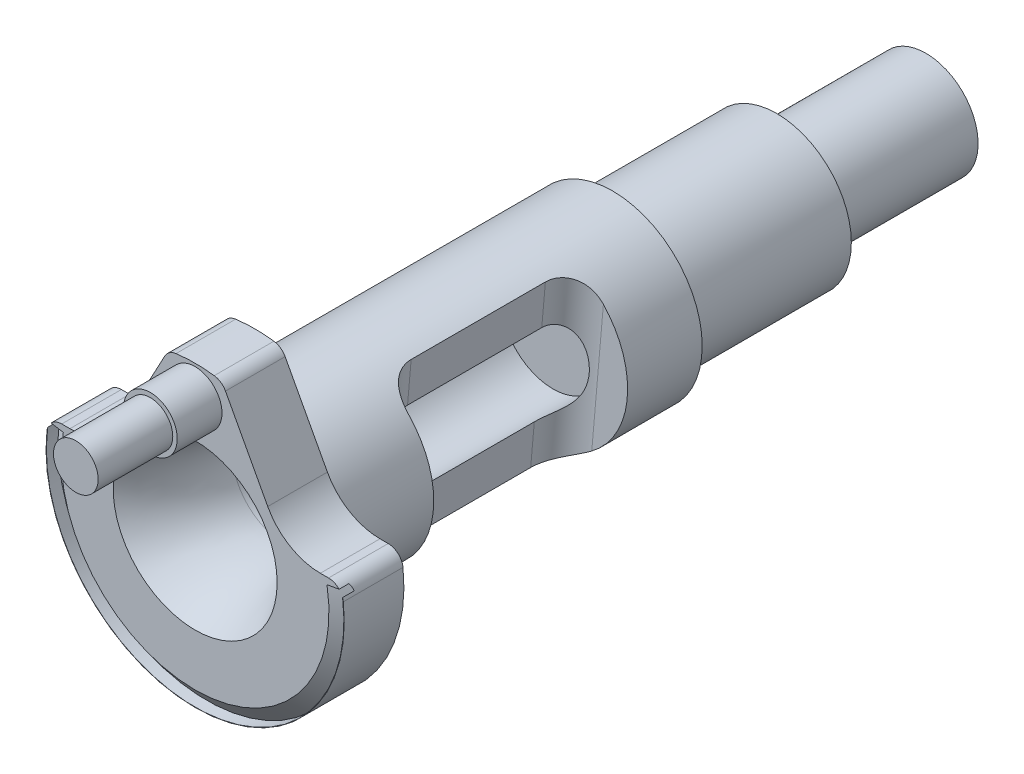
from build123d import *

# Parameters (mm, degrees)
SKETCH1_R           = 5
BOSS_EXTRUDE1_DEPTH = 35
SKETCH3_R           = 10
BOSS_EXTRUDE3_DEPTH = 4
BOSS_EXTRUDE4_START = 24
SKETCH4_R           = 6
SKETCH4_R_2         = 5
BOSS_EXTRUDE4_DEPTH = 24
CUT_EXTRUDE1_DEPTH  = 42.484937025
FILLET1_R           = 1
SKETCH6_R           = 3.5
CUT_EXTRUDE2_DEPTH  = 24
CHAMFER1_SIZE       = 2
FILLET2_R           = 10
SKETCH7_R           = 1.5
BOSS_EXTRUDE5_DEPTH = 8
FILLET3_R           = 4
CUT_REVOLVE1_ANGLE  = 200
SKETCH9_R           = 1.8
SKETCH9_R_2         = 1.5
BOSS_EXTRUDE6_DEPTH = 3
SKETCH10_R          = 3.5
BOSS_EXTRUDE7_DEPTH = 10
SKETCH14_W          = 13
SKETCH14_H          = 12
CUT_EXTRUDE3_DEPTH  = 4
FILLET4_R           = 2


with BuildPart() as part:
    # Sketch1 → Boss-Extrude1 (new body)
    with BuildSketch(Plane.XY):
        Circle(SKETCH1_R)
    extrude(amount=BOSS_EXTRUDE1_DEPTH)

    # Sketch3 → Boss-Extrude3 (add)
    with BuildSketch(Plane.XY.offset(35)):
        Circle(SKETCH3_R)
    extrude(amount=BOSS_EXTRUDE3_DEPTH)

    # Sketch4 → Boss-Extrude4 (add)
    with BuildSketch(Plane(origin=(0, 0, 35), x_dir=(-1, 0, 0), z_dir=(0, 0, -1)).offset(BOSS_EXTRUDE4_START)):
        with Locations(Location((0, 0, 0), (0, 0, 180))):
            Circle(SKETCH4_R)
        Circle(SKETCH4_R_2, mode=Mode.SUBTRACT)
    extrude(amount=-BOSS_EXTRUDE4_DEPTH)

    # Sketch5 → Cut-Extrude1 (cut, through all)
    with BuildSketch(Plane.XY.offset(39)):
        with BuildLine():
            ThreePointArc((-1.8, 9.836666102), (-6.99867823, 7.142723782), (-9.797958971, 2))
            Line((-9.797958971, 2), (-6, 2))
            Line((-6, 2), (-1.8, 9.836666102))
        make_face()
        with BuildLine():
            ThreePointArc((9.797958971, 2), (6.99867823, 7.142723782), (1.8, 9.836666102))
            Line((1.8, 9.836666102), (6, 2))
            Line((6, 2), (9.797958971, 2))
        make_face()
    extrude(amount=-CUT_EXTRUDE1_DEPTH, mode=Mode.SUBTRACT)

    # Fillet1
    fillet1_edges = [part.edges().sort_by_distance(p)[0] for p in [
        (-9.797958971, 2, 37),
        (-1.8, 9.836666102, 37),
        (1.8, 9.836666102, 37),
        (9.797958971, 2, 37),
    ]]
    fillet(fillet1_edges, radius=FILLET1_R)

    # Sketch6 → Cut-Extrude2 (cut)
    with BuildSketch(Plane.XY.offset(39)):
        Circle(SKETCH6_R)
    extrude(amount=-CUT_EXTRUDE2_DEPTH, mode=Mode.SUBTRACT)

    # Chamfer1
    chamfer1_edges = [part.edges().sort_by_distance(p)[0] for p in [
        (-3.5, 0, 39),
    ]]
    chamfer(chamfer1_edges, length=CHAMFER1_SIZE)

    # Fillet2
    # the kernel refuses this fillet: 10 mm, written as the material it takes off along each edge
    with BuildSketch(Plane(origin=(0, 0, 37), x_dir=(1, 0, 0), z_dir=(0, -1, 0))) as fillet2_piece_1:
        with BuildLine():
            CenterArc((13.5, -4), FILLET2_R, 143.130102354, 36.869897646)
            Line((3.5, -4), (3.3, -4))
            Line((3.3, -4), (3.3, 0))
            Line((3.3, 0), (3.358578644, 0.141421356))
            ThreePointArc((3.358578644, 0.141421356), (4.358578644, 1.141421356), (5.34, 2.12))
            Line((5.34, 2.12), (5.5, 2))
        make_face()
    revolve(axis=Axis((0, 0, 37), (0, 0, 1)), mode=Mode.SUBTRACT)

    # Sketch7 → Boss-Extrude5 (add)
    with BuildSketch(Plane.XY.offset(39)):
        with Locations((0, 8)):
            Circle(SKETCH7_R)
    extrude(amount=BOSS_EXTRUDE5_DEPTH)

    # Fillet3
    fillet3_edges = [part.edges().sort_by_distance(p)[0] for p in [
        (-6, 2, 37),
        (6, 2, 37),
    ]]
    fillet(fillet3_edges, radius=FILLET3_R)

    # Sketch8 → Cut-Revolve1 (revolve, symmetric, cut)
    with BuildSketch(Plane(origin=(0, 0, 0), x_dir=(0, 0, -1), z_dir=(1, 0, 0))) as cut_revolve1_sk:
        Polygon((-38.217890117, -9.976578367), (-39, -8.976578367), (-39, -9.976578367), align=None)
    revolve(axis=Axis((0, 0, 1000), (0, 0, -1)), revolution_arc=CUT_REVOLVE1_ANGLE / 2, mode=Mode.SUBTRACT)
    revolve(cut_revolve1_sk.sketch, axis=Axis((0, 0, 1000), (0, 0, 1)), revolution_arc=CUT_REVOLVE1_ANGLE / 2, mode=Mode.SUBTRACT)

    # Sketch9 → Boss-Extrude6 (add)
    with BuildSketch(Plane.XY.offset(39)):
        with Locations((0, 8)):
            Circle(SKETCH9_R)
        with Locations((0, 8)):
            Circle(SKETCH9_R_2, mode=Mode.SUBTRACT)
    extrude(amount=BOSS_EXTRUDE6_DEPTH)

    # Sketch10 → Boss-Extrude7 (add)
    with BuildSketch(Plane(origin=(0, 0, 0), x_dir=(-1, 0, 0), z_dir=(0, 0, -1))):
        with Locations(Location((0, 0, 0), (0, 0, 180))):
            Circle(SKETCH10_R)
    extrude(amount=BOSS_EXTRUDE7_DEPTH)

    # Sketch14 → Cut-Extrude3 (cut)
    with BuildSketch(Plane(origin=(5.977168189, -0.522934456, 0), x_dir=(0, 0, -1), z_dir=(0.9961946980917453, -0.08715574274766187, 0))):
        with Locations((-22.5, 0)):
            Rectangle(SKETCH14_W, SKETCH14_H)
    extrude(amount=-CUT_EXTRUDE3_DEPTH, mode=Mode.SUBTRACT)

    # Fillet4
    # the kernel refuses this fillet: 2 mm, written as the material it adds along each edge
    with BuildSketch(Plane(origin=(1.806946495, -2.29393355, 16), x_dir=(0, 0, 1), z_dir=(0.08715574274766187, 0.9961946980917453, 0))) as fillet4_piece_1_section:
        with BuildLine():
            CenterArc((FILLET4_R, FILLET4_R), FILLET4_R, 180, 90)
            Line((0, FILLET4_R), (0, 0))
            Line((0, 0), (FILLET4_R, 0))
        make_face()
    fillet4_piece_1 = extrude(amount=12.784572926, mode=Mode.PRIVATE)
    fillet4_piece_1 = fillet4_piece_1 - Plane(origin=(0, 0, 16.407191897), x_dir=(1, 0, 0), z_dir=(0, 0, 1)) * Cylinder(3.5, 34, mode=Mode.PRIVATE)
    fillet4_piece_1 = fillet4_piece_1 & Plane(origin=(0, 0, 16.407191897), x_dir=(1, 0, 0), z_dir=(0, 0, -1)) * Cylinder(6, 34, mode=Mode.PRIVATE)
    add(fillet4_piece_1)
    with BuildSketch(Plane(origin=(1.063583349, -10.790613187, 16), x_dir=(0.9961946980917453, -0.08715574274766187, 0), z_dir=(0.08715574274766187, 0.9961946980917453, 0))) as fillet4_piece_2_section:
        with BuildLine():
            CenterArc((FILLET4_R, -FILLET4_R), FILLET4_R, 90, 90)
            Line((0, -FILLET4_R), (0, 0))
            Line((0, 0), (FILLET4_R, 0))
        make_face()
    fillet4_piece_2 = extrude(amount=12.784572926, mode=Mode.PRIVATE)
    fillet4_piece_2 = fillet4_piece_2 - Plane(origin=(0, 0, 16.407193431), x_dir=(1, 0, 0), z_dir=(0, 0, 1)) * Cylinder(3.5, 34, mode=Mode.PRIVATE)
    fillet4_piece_2 = fillet4_piece_2 & Plane(origin=(0, 0, 16.407193431), x_dir=(1, 0, 0), z_dir=(0, 0, -1)) * Cylinder(6, 34, mode=Mode.PRIVATE)
    add(fillet4_piece_2)
    with BuildSketch(Plane(origin=(2.177832298, 1.945310579, 29), x_dir=(0, 0, -1), z_dir=(-0.08715574274766187, -0.9961946980917453, 0))) as fillet4_piece_3_section:
        with BuildLine():
            CenterArc((FILLET4_R, FILLET4_R), FILLET4_R, 180, 90)
            Line((0, FILLET4_R), (0, 0))
            Line((0, 0), (FILLET4_R, 0))
        make_face()
    fillet4_piece_3 = extrude(amount=12.784572926, mode=Mode.PRIVATE)
    fillet4_piece_3 = fillet4_piece_3 - Plane(origin=(0, 0, 28.592806917), x_dir=(1, 0, 0), z_dir=(0, 0, 1)) * Cylinder(3.5, 34, mode=Mode.PRIVATE)
    fillet4_piece_3 = fillet4_piece_3 & Plane(origin=(0, 0, 28.592806917), x_dir=(1, 0, 0), z_dir=(0, 0, -1)) * Cylinder(6, 34, mode=Mode.PRIVATE)
    add(fillet4_piece_3)
    with BuildSketch(Plane(origin=(2.921195444, 10.441990216, 29), x_dir=(0, 0, -1), z_dir=(-0.08715574274766187, -0.9961946980917453, 0))) as fillet4_piece_4_section:
        with BuildLine():
            CenterArc((FILLET4_R, FILLET4_R), FILLET4_R, 180, 90)
            Line((0, FILLET4_R), (0, 0))
            Line((0, 0), (FILLET4_R, 0))
        make_face()
    fillet4_piece_4 = extrude(amount=12.784572926, mode=Mode.PRIVATE)
    fillet4_piece_4 = fillet4_piece_4 - Plane(origin=(0, 0, 28.592808103), x_dir=(1, 0, 0), z_dir=(0, 0, 1)) * Cylinder(3.5, 34, mode=Mode.PRIVATE)
    fillet4_piece_4 = fillet4_piece_4 & Plane(origin=(0, 0, 28.592808103), x_dir=(1, 0, 0), z_dir=(0, 0, -1)) * Cylinder(6, 34, mode=Mode.PRIVATE)
    add(fillet4_piece_4)


solid = part.part
